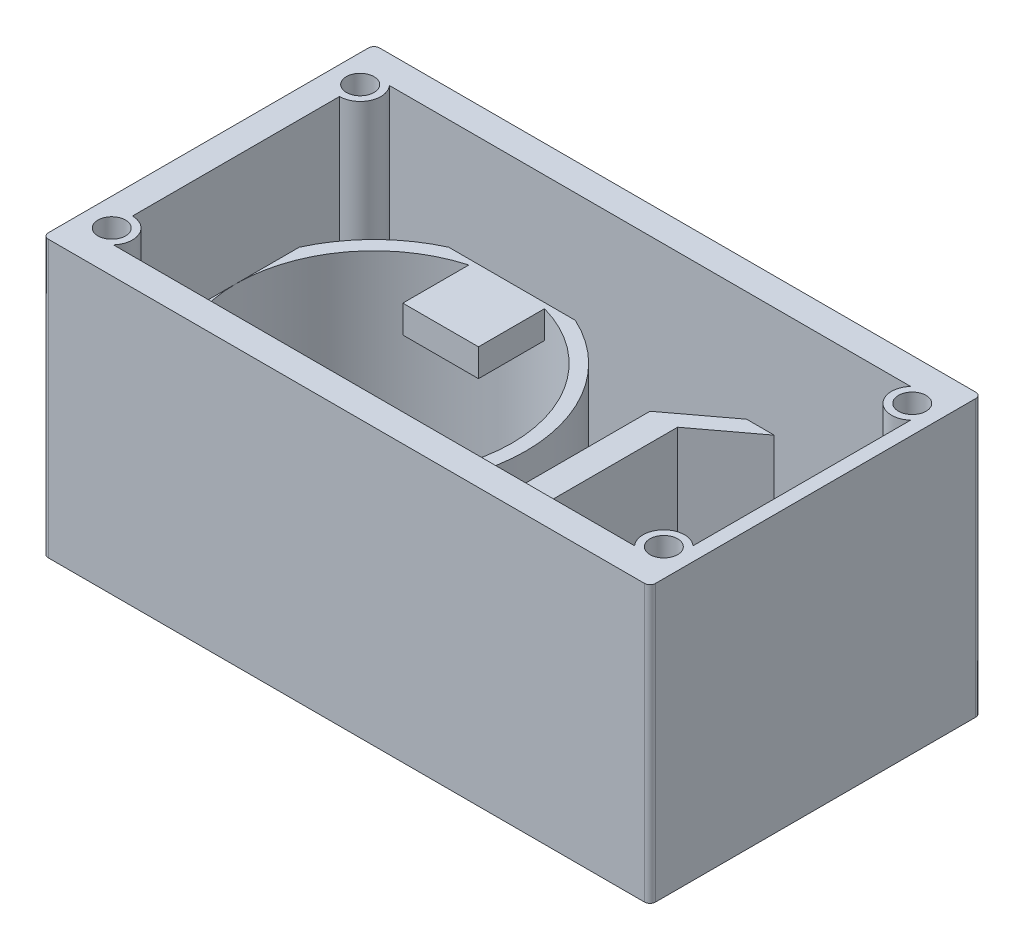
from build123d import *
from build123d.topology import SkipClean

# Parameters (mm, degrees)
SKETCH1_W                 = 22
SKETCH1_H                 = 12
BOSS_EXTRUDE1_DEPTH       = 10
SKETCH2_W                 = 20.5
SKETCH2_H                 = 10
CUT_EXTRUDE1_DEPTH        = 9
FILLET1_R                 = 0.2
SKETCH3_R                 = 5
CUT_EXTRUDE2_DEPTH        = 17.031219542
SKETCH4_R                 = 0.5
CUT_EXTRUDE3_DEPTH        = 17.031219542
SKETCH5_R                 = 2
CUT_EXTRUDE4_DEPTH        = 17.031219542
BOSS_EXTRUDE2_DEPTH       = 5
SKETCH9_R                 = 5.5
SKETCH9_R_2               = 5
BOSS_EXTRUDE3_DEPTH       = 5
SKETCH10_R                = 1
SKETCH10_R_2              = 0.5
BOSS_EXTRUDE4_DEPTH       = 2
BOSS_EXTRUDE6_START       = -1
SKETCH12_R                = 0.5
BOSS_EXTRUDE6_DEPTH       = 1
SKETCH13_R                = 0.75
SKETCH13_R_2              = 0.5
BOSS_EXTRUDE7_DEPTH       = 9
SKETCH14_R                = 0.5
CUT_EXTRUDE5_DEPTH        = 17.031219542
MIRROR2_COPY_1_SKETCH_R   = 0.75
MIRROR2_COPY_1_SKETCH_R_2 = 0.5
MIRROR2_COPY_1_DEPTH      = 9
MIRROR2_COPY_2_SKETCH_R   = 0.5
MIRROR2_COPY_2_DEPTH      = 17.031219542
MIRROR2_COPY_3_SKETCH_R   = 0.75
MIRROR2_COPY_3_SKETCH_R_2 = 0.5
MIRROR2_COPY_3_DEPTH      = 9
MIRROR2_COPY_4_SKETCH_R   = 0.5
MIRROR2_COPY_4_DEPTH      = 17.031219542
SKETCH15_W                = 2.741193842
SKETCH15_H                = 3.121519946
BOSS_EXTRUDE8_DEPTH       = 1


with BuildPart() as part:
    # Sketch1 → Boss-Extrude1 (new body)
    with BuildSketch(Plane(origin=(0, 0, 0), x_dir=(1, 0, 0), z_dir=(0, 1, 0))):
        Rectangle(SKETCH1_W, SKETCH1_H)
    extrude(amount=BOSS_EXTRUDE1_DEPTH)

    # Sketch2 → Cut-Extrude1 (cut)
    with BuildSketch(Plane(origin=(0, 10, 0), x_dir=(1, 0, 0), z_dir=(0, 1, 0))):
        with Locations((0.25, 0)):
            Rectangle(SKETCH2_W, SKETCH2_H)
    extrude(amount=-CUT_EXTRUDE1_DEPTH, mode=Mode.SUBTRACT)

    # Fillet1
    fillet1_edges = [part.edges().sort_by_distance(p)[0] for p in [
        (-11, 5, -6),
        (11, 5, -6),
        (11, 5, 6),
        (-11, 5, 6),
    ]]
    fillet(fillet1_edges, radius=FILLET1_R)

    # Sketch3 → Cut-Extrude2 (cut, through all)
    with BuildSketch(Plane(origin=(0, 0, 0), x_dir=(-1, 0, 0), z_dir=(0, -1, 0))):
        with Locations((5, 0)):
            Circle(SKETCH3_R)
    extrude(amount=-CUT_EXTRUDE2_DEPTH, mode=Mode.SUBTRACT)

    # Sketch4 → Cut-Extrude3 (cut, through all)
    with BuildSketch(Plane(origin=(0, 0, 0), x_dir=(-1, 0, 0), z_dir=(0, -1, 0))):
        with Locations((-1, 0)):
            Circle(SKETCH4_R)
    extrude(amount=-CUT_EXTRUDE3_DEPTH, mode=Mode.SUBTRACT)

    # Sketch5 → Cut-Extrude4 (cut, through all)
    with BuildSketch(Plane(origin=(0, 0, 0), x_dir=(-1, 0, 0), z_dir=(0, -1, 0))):
        with Locations((-6.5, 0)):
            Circle(SKETCH5_R)
    extrude(amount=-CUT_EXTRUDE4_DEPTH, mode=Mode.SUBTRACT)

    # Sketch6 → Boss-Extrude2 (add)
    with BuildSketch(Plane(origin=(0, 1, 0), x_dir=(1, 0, 0), z_dir=(0, 1, 0))):
        Polygon((2.5, -3.5), (2.5, 3.5), (4.5, 5), (3.5, 5), (1.5, 3.5), (1.5, -3.5), (3.5, -5), (4.5, -5), align=None)
    extrude(amount=BOSS_EXTRUDE2_DEPTH)

    # Sketch9 → Boss-Extrude3 (add)
    with SkipClean():  # the faces are left unmerged after this step: merging them gives an invalid solid
        with BuildSketch(Plane(origin=(0, 1, 0), x_dir=(1, 0, 0), z_dir=(0, 1, 0))):
            with Locations((-5, 0)):
                Circle(SKETCH9_R)
            with Locations((-5, 0)):
                Circle(SKETCH9_R_2, mode=Mode.SUBTRACT)
        extrude(amount=BOSS_EXTRUDE3_DEPTH)

    # Sketch10 → Boss-Extrude4 (add)
    with SkipClean():  # the faces are left unmerged after this step: merging them gives an invalid solid
        with BuildSketch(Plane(origin=(0, 1, 0), x_dir=(1, 0, 0), z_dir=(0, 1, 0))):
            with Locations((1, 0)):
                Circle(SKETCH10_R)
            with Locations((1, 0)):
                Circle(SKETCH10_R_2, mode=Mode.SUBTRACT)
        extrude(amount=BOSS_EXTRUDE4_DEPTH)

    # Sketch12 → Boss-Extrude6 (add)
    with SkipClean():  # the faces are left unmerged after this step: merging them gives an invalid solid
        with BuildSketch(Plane(origin=(0, 3, 0), x_dir=(1, 0, 0), z_dir=(0, 1, 0)).offset(BOSS_EXTRUDE6_START)):
            with Locations((1, 0)):
                Circle(SKETCH12_R)
        extrude(amount=BOSS_EXTRUDE6_DEPTH)

    # Sketch13 → Boss-Extrude7 (add)
    with SkipClean():  # the faces are left unmerged after this step: merging them gives an invalid solid
        with BuildSketch(Plane(origin=(0, 1, 0), x_dir=(1, 0, 0), z_dir=(0, 1, 0))):
            with Locations((10, 4.5)):
                Circle(SKETCH13_R)
            with Locations((10, 4.5)):
                Circle(SKETCH13_R_2, mode=Mode.SUBTRACT)
        boss_extrude7 = extrude(amount=BOSS_EXTRUDE7_DEPTH)

    # Sketch14 → Cut-Extrude5 (cut, through all)
    with SkipClean():  # the faces are left unmerged after this step: merging them gives an invalid solid
        with BuildSketch(Plane(origin=(0, 0, 0), x_dir=(-1, 0, 0), z_dir=(0, -1, 0))):
            with Locations((-10, 4.5)):
                Circle(SKETCH14_R)
        cut_extrude5 = extrude(amount=-CUT_EXTRUDE5_DEPTH, mode=Mode.SUBTRACT)

    # Mirror1: Boss-Extrude7, Cut-Extrude5 across plane
    with SkipClean():  # the faces are left unmerged after this step: merging them gives an invalid solid
        add(boss_extrude7.mirror(Plane(origin=(0, 0, 0), x_dir=(0, 0, 1), z_dir=(1, 0, 0))))
        add(cut_extrude5.mirror(Plane(origin=(0, 0, 0), x_dir=(0, 0, 1), z_dir=(1, 0, 0))), mode=Mode.SUBTRACT)

    # Mirror2 copy 1 sketch → Mirror2 copy 1 (add)
    with SkipClean():  # the faces are left unmerged after this step: merging them gives an invalid solid
        with BuildSketch(Plane(origin=(0, 1, 0), x_dir=(-1, 0, 0), z_dir=(0, 1, 0))):
            with Locations((10, 4.5)):
                Circle(MIRROR2_COPY_1_SKETCH_R)
            with Locations((10, 4.5)):
                Circle(MIRROR2_COPY_1_SKETCH_R_2, mode=Mode.SUBTRACT)
        extrude(amount=MIRROR2_COPY_1_DEPTH)

    # Mirror2 copy 2 sketch → Mirror2 copy 2 (cut, through all)
    with SkipClean():  # the faces are left unmerged after this step: merging them gives an invalid solid
        with BuildSketch(Plane.XZ):
            with Locations((-10, 4.5)):
                Circle(MIRROR2_COPY_2_SKETCH_R)
        extrude(amount=-MIRROR2_COPY_2_DEPTH, mode=Mode.SUBTRACT)

    # Mirror2 copy 3 sketch → Mirror2 copy 3 (add)
    with SkipClean():  # the faces are left unmerged after this step: merging them gives an invalid solid
        with BuildSketch(Plane(origin=(0, 1, 0), x_dir=(1, 0, 0), z_dir=(0, 1, 0))):
            with Locations((10, -4.5)):
                Circle(MIRROR2_COPY_3_SKETCH_R)
            with Locations((10, -4.5)):
                Circle(MIRROR2_COPY_3_SKETCH_R_2, mode=Mode.SUBTRACT)
        extrude(amount=MIRROR2_COPY_3_DEPTH)

    # Mirror2 copy 4 sketch → Mirror2 copy 4 (cut, through all)
    with SkipClean():  # the faces are left unmerged after this step: merging them gives an invalid solid
        with BuildSketch(Plane(origin=(0, 0, 0), x_dir=(-1, 0, 0), z_dir=(0, -1, 0))):
            with Locations((-10, -4.5)):
                Circle(MIRROR2_COPY_4_SKETCH_R)
        extrude(amount=-MIRROR2_COPY_4_DEPTH, mode=Mode.SUBTRACT)

    # Sketch15 → Boss-Extrude8 (add)
    with SkipClean():  # the faces are left unmerged after this step: merging them gives an invalid solid
        with BuildSketch(Plane(origin=(0, 6, 0), x_dir=(1, 0, 0), z_dir=(0, 1, 0))):
            with Locations((-5, 3.975545746)):
                Rectangle(SKETCH15_W, SKETCH15_H)
            with Locations((-5, -3.975545746)):
                Rectangle(SKETCH15_W, SKETCH15_H)
        extrude(amount=-BOSS_EXTRUDE8_DEPTH)


solid = part.part
